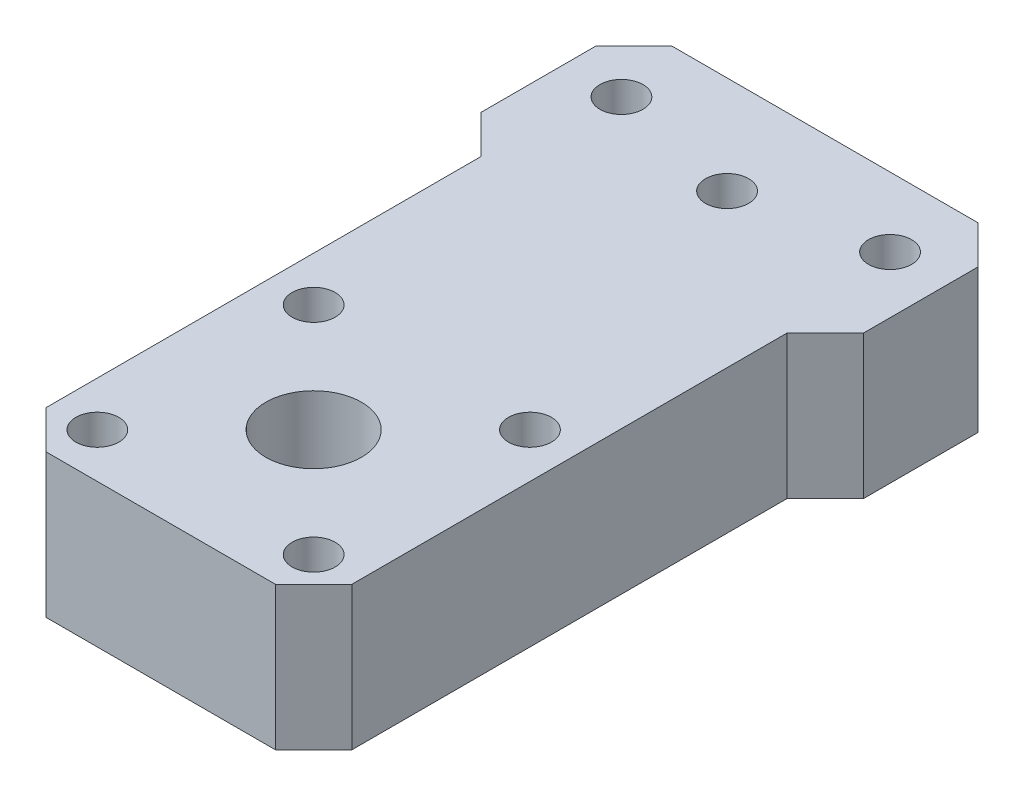
from build123d import *

# Parameters (mm, degrees)
SKETCH1_W           = 32
SKETCH1_H           = 69.5
SKETCH1_R           = 5
SKETCH1_R_2         = 2.25
BOSS_EXTRUDE1_DEPTH = 15
SKETCH7_W           = 40
SKETCH7_H           = 16
BOSS_EXTRUDE6_DEPTH = 15
SKETCH5_R           = 2.25
CUT_EXTRUDE2_DEPTH  = 60.052942348
CHAMFER1_SIZE       = 4


with BuildPart() as part:
    # Sketch1 → Boss-Extrude1 (new body)
    with BuildSketch(Plane(origin=(0, 0, 0), x_dir=(1, 0, 0), z_dir=(0, 1, 0))):
        with Locations((0, 18.75)):
            Rectangle(SKETCH1_W, SKETCH1_H)
        with Locations(Location((0, 0, 0), (0, 0, 270))):
            Circle(SKETCH1_R, mode=Mode.SUBTRACT)
        with Locations(Location((11.313708499, -11.313708499, 0), (0, 0, 270))):
            Circle(SKETCH1_R_2, mode=Mode.SUBTRACT)
        with Locations(Location((11.313708499, 11.313708499, 0), (0, 0, 270))):
            Circle(SKETCH1_R_2, mode=Mode.SUBTRACT)
        with Locations(Location((-11.313708499, 11.313708499, 0), (0, 0, 270))):
            Circle(SKETCH1_R_2, mode=Mode.SUBTRACT)
        with Locations(Location((-11.313708499, -11.313708499, 0), (0, 0, 270))):
            Circle(SKETCH1_R_2, mode=Mode.SUBTRACT)
    extrude(amount=BOSS_EXTRUDE1_DEPTH)

    # Sketch7 → Boss-Extrude6 (add)
    with BuildSketch(Plane(origin=(0, 0, 0), x_dir=(1, 0, 0), z_dir=(0, 1, 0))):
        with Locations((0, 45.5)):
            Rectangle(SKETCH7_W, SKETCH7_H)
    extrude(amount=BOSS_EXTRUDE6_DEPTH)

    # Sketch5 → Cut-Extrude2 (cut, through all)
    with BuildSketch(Plane(origin=(0, 0, 0), x_dir=(1, 0, 0), z_dir=(0, 1, 0))):
        with Locations(Location((0, 43.25, 0), (0, 0, 270))):
            Circle(SKETCH5_R)
        with Locations(Location((14.05, 46.25, 0), (0, 0, 270))):
            Circle(SKETCH5_R)
        with Locations(Location((-14.05, 46.25, 0), (0, 0, 270))):
            Circle(SKETCH5_R)
    extrude(amount=CUT_EXTRUDE2_DEPTH, mode=Mode.SUBTRACT)

    # Chamfer1
    chamfer1_edges = [part.edges().sort_by_distance(p)[0] for p in [
        (16, 7.5, 16),
        (-16, 7.5, 16),
        (-16, 7.5, -37.5),
        (16, 7.5, -37.5),
        (20, 7.5, -53.5),
        (-20, 7.5, -53.5),
    ]]
    chamfer(chamfer1_edges, length=CHAMFER1_SIZE - 0.0001)  # a hair under: the kernel refuses the full size


solid = part.part
